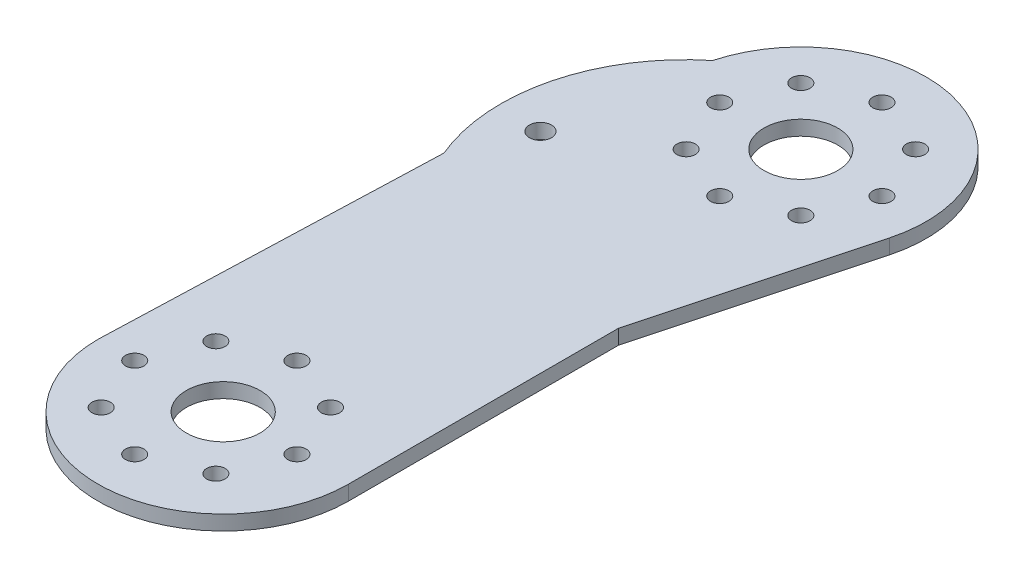
from build123d import *

# Parameters (mm, degrees)
RESSALTO_EXTRUS_O1_DEPTH      = 3
CORTE_EXTRUS_O8_REACH         = 92.666
ESBO_O7_R                     = 1.25
CORTE_EXTRUS_O9_REACH         = 92.666
ESBO_O8_R                     = 5
ESBO_O8_R_2                   = 1.5
CORTE_EXTRUS_O11_REACH        = 92.666
ESBO_O9_R                     = 1.25
CORTE_EXTRUS_O12_REACH        = 92.666
ESBO_O11_R                    = 5
CONVERTER_S_LIDO1_OUTLINE_R   = 1.25
CONVERTER_S_LIDO1_OUTLINE_R_2 = 5
CONVERTER_S_LIDO1_OUTLINE_R_3 = 1.5
CONVERTER_S_LIDO1_DEPTH       = 1


# Read off the part's stored shape, not the designer's step: Converter-Sólido1
with BuildPart() as part:
    # Esboço1 → Ressalto-extrusão1 (new body)
    with BuildSketch(Plane(origin=(0, 0, 0), x_dir=(1, 0, 0), z_dir=(0, 1, 0))):
        with BuildLine():
            Line((17, 36.622301445), (24.764571353, 65.600076233))
            ThreePointArc((24.764571353, 65.600076233), (12.765450327, 86.414910724), (-8.065221434, 74.443304555))
            ThreePointArc((-8.065221434, 74.443304555), (-16.588225274, 61.125706966), (-15.416069793, 45.357826591))
            Line((-15.416069793, 45.357826591), (-17, 0))
            ThreePointArc((-17, 0), (0, -17), (17, 0))
            Line((17, 0), (17, 36.622301445))
        make_face()
    extrude(amount=RESSALTO_EXTRUS_O1_DEPTH)

    # Esboço7 → Corte-extrusão8 (cut, up to next)
    with BuildSketch(Plane.XZ, mode=Mode.PRIVATE) as corte_extrus_o8_sk1:
        with Locations(Location((-1, -11, 0), (0, 0, 270))):
            Circle(ESBO_O7_R)
    corte_extrus_o8_tool1 = extrude(corte_extrus_o8_sk1.sketch, amount=-CORTE_EXTRUS_O8_REACH, mode=Mode.PRIVATE) & part.part
    # Esboço7 → Corte-extrusão8 (cut, up to next)
    with BuildSketch(Plane.XZ, mode=Mode.PRIVATE) as corte_extrus_o8_sk2:
        with Locations(Location((-8.778174593, -7.778174593, 0), (0, 0, 270))):
            Circle(ESBO_O7_R)
    corte_extrus_o8_tool2 = extrude(corte_extrus_o8_sk2.sketch, amount=-CORTE_EXTRUS_O8_REACH, mode=Mode.PRIVATE) & part.part
    # Esboço7 → Corte-extrusão8 (cut, up to next)
    with BuildSketch(Plane.XZ, mode=Mode.PRIVATE) as corte_extrus_o8_sk3:
        with Locations(Location((-12, 0, 0), (0, 0, 270))):
            Circle(ESBO_O7_R)
    corte_extrus_o8_tool3 = extrude(corte_extrus_o8_sk3.sketch, amount=-CORTE_EXTRUS_O8_REACH, mode=Mode.PRIVATE) & part.part
    # Esboço7 → Corte-extrusão8 (cut, up to next)
    with BuildSketch(Plane.XZ, mode=Mode.PRIVATE) as corte_extrus_o8_sk4:
        with Locations(Location((-8.778174593, 7.778174593, 0), (0, 0, 270))):
            Circle(ESBO_O7_R)
    corte_extrus_o8_tool4 = extrude(corte_extrus_o8_sk4.sketch, amount=-CORTE_EXTRUS_O8_REACH, mode=Mode.PRIVATE) & part.part
    # Esboço7 → Corte-extrusão8 (cut, up to next)
    with BuildSketch(Plane.XZ, mode=Mode.PRIVATE) as corte_extrus_o8_sk5:
        with Locations(Location((-1, 11, 0), (0, 0, 270))):
            Circle(ESBO_O7_R)
    corte_extrus_o8_tool5 = extrude(corte_extrus_o8_sk5.sketch, amount=-CORTE_EXTRUS_O8_REACH, mode=Mode.PRIVATE) & part.part
    # Esboço7 → Corte-extrusão8 (cut, up to next)
    with BuildSketch(Plane.XZ, mode=Mode.PRIVATE) as corte_extrus_o8_sk6:
        with Locations(Location((6.778174593, 7.778174593, 0), (0, 0, 270))):
            Circle(ESBO_O7_R)
    corte_extrus_o8_tool6 = extrude(corte_extrus_o8_sk6.sketch, amount=-CORTE_EXTRUS_O8_REACH, mode=Mode.PRIVATE) & part.part
    # Esboço7 → Corte-extrusão8 (cut, up to next)
    with BuildSketch(Plane.XZ, mode=Mode.PRIVATE) as corte_extrus_o8_sk7:
        with Locations(Location((10, 0, 0), (0, 0, 270))):
            Circle(ESBO_O7_R)
    corte_extrus_o8_tool7 = extrude(corte_extrus_o8_sk7.sketch, amount=-CORTE_EXTRUS_O8_REACH, mode=Mode.PRIVATE) & part.part
    # Esboço7 → Corte-extrusão8 (cut, up to next)
    with BuildSketch(Plane.XZ, mode=Mode.PRIVATE) as corte_extrus_o8_sk8:
        with Locations(Location((6.778174593, -7.778174593, 0), (0, 0, 270))):
            Circle(ESBO_O7_R)
    corte_extrus_o8_tool8 = extrude(corte_extrus_o8_sk8.sketch, amount=-CORTE_EXTRUS_O8_REACH, mode=Mode.PRIVATE) & part.part
    add(corte_extrus_o8_tool1.solids().sort_by_distance((-1, 0, -11))[0], mode=Mode.SUBTRACT)
    add(corte_extrus_o8_tool2.solids().sort_by_distance((-8.778175, 0, -7.778175))[0], mode=Mode.SUBTRACT)
    add(corte_extrus_o8_tool3.solids().sort_by_distance((-12, 0, 0))[0], mode=Mode.SUBTRACT)
    add(corte_extrus_o8_tool4.solids().sort_by_distance((-8.778175, 0, 7.778175))[0], mode=Mode.SUBTRACT)
    add(corte_extrus_o8_tool5.solids().sort_by_distance((-1, 0, 11))[0], mode=Mode.SUBTRACT)
    add(corte_extrus_o8_tool6.solids().sort_by_distance((6.778175, 0, 7.778175))[0], mode=Mode.SUBTRACT)
    add(corte_extrus_o8_tool7.solids().sort_by_distance((10, 0, 0))[0], mode=Mode.SUBTRACT)
    add(corte_extrus_o8_tool8.solids().sort_by_distance((6.778175, 0, -7.778175))[0], mode=Mode.SUBTRACT)

    # Esboço8 → Corte-extrusão9 (cut, up to next)
    with BuildSketch(Plane(origin=(0, 3, 0), x_dir=(1, 0, 0), z_dir=(0, 1, 0)), mode=Mode.PRIVATE) as corte_extrus_o9_sk1:
        with Locations(Location((0, 0, 0), (0, 0, 270))):
            Circle(ESBO_O8_R)
    corte_extrus_o9_tool1 = extrude(corte_extrus_o9_sk1.sketch, amount=-CORTE_EXTRUS_O9_REACH, mode=Mode.PRIVATE) & part.part
    # Esboço8 → Corte-extrusão9 (cut, up to next)
    with BuildSketch(Plane(origin=(0, 3, 0), x_dir=(1, 0, 0), z_dir=(0, 1, 0)), mode=Mode.PRIVATE) as corte_extrus_o9_sk2:
        with Locations(Location((-11.416069793, 54.443304555, 0), (0, 0, 270))):
            Circle(ESBO_O8_R_2)
    corte_extrus_o9_tool2 = extrude(corte_extrus_o9_sk2.sketch, amount=-CORTE_EXTRUS_O9_REACH, mode=Mode.PRIVATE) & part.part
    add(corte_extrus_o9_tool1.solids().sort_by_distance((0, 3, 0))[0], mode=Mode.SUBTRACT)
    add(corte_extrus_o9_tool2.solids().sort_by_distance((-11.41607, 3, -54.443305))[0], mode=Mode.SUBTRACT)

    # Esboço9 → Corte-extrusão11 (cut, up to next)
    with BuildSketch(Plane(origin=(0, 3, 0), x_dir=(1, 0, 0), z_dir=(0, 1, 0)), mode=Mode.PRIVATE) as corte_extrus_o11_sk1:
        with Locations(Location((8.343832306, 81, 0), (0, 0, 270))):
            Circle(ESBO_O9_R)
    corte_extrus_o11_tool1 = extrude(corte_extrus_o11_sk1.sketch, amount=-CORTE_EXTRUS_O11_REACH, mode=Mode.PRIVATE) & part.part
    # Esboço9 → Corte-extrusão11 (cut, up to next)
    with BuildSketch(Plane(origin=(0, 3, 0), x_dir=(1, 0, 0), z_dir=(0, 1, 0)), mode=Mode.PRIVATE) as corte_extrus_o11_sk2:
        with Locations(Location((16.122006899, 77.778174593, 0), (0, 0, 270))):
            Circle(ESBO_O9_R)
    corte_extrus_o11_tool2 = extrude(corte_extrus_o11_sk2.sketch, amount=-CORTE_EXTRUS_O11_REACH, mode=Mode.PRIVATE) & part.part
    # Esboço9 → Corte-extrusão11 (cut, up to next)
    with BuildSketch(Plane(origin=(0, 3, 0), x_dir=(1, 0, 0), z_dir=(0, 1, 0)), mode=Mode.PRIVATE) as corte_extrus_o11_sk3:
        with Locations(Location((19.343832306, 70, 0), (0, 0, 270))):
            Circle(ESBO_O9_R)
    corte_extrus_o11_tool3 = extrude(corte_extrus_o11_sk3.sketch, amount=-CORTE_EXTRUS_O11_REACH, mode=Mode.PRIVATE) & part.part
    # Esboço9 → Corte-extrusão11 (cut, up to next)
    with BuildSketch(Plane(origin=(0, 3, 0), x_dir=(1, 0, 0), z_dir=(0, 1, 0)), mode=Mode.PRIVATE) as corte_extrus_o11_sk4:
        with Locations(Location((16.122006899, 62.221825407, 0), (0, 0, 270))):
            Circle(ESBO_O9_R)
    corte_extrus_o11_tool4 = extrude(corte_extrus_o11_sk4.sketch, amount=-CORTE_EXTRUS_O11_REACH, mode=Mode.PRIVATE) & part.part
    # Esboço9 → Corte-extrusão11 (cut, up to next)
    with BuildSketch(Plane(origin=(0, 3, 0), x_dir=(1, 0, 0), z_dir=(0, 1, 0)), mode=Mode.PRIVATE) as corte_extrus_o11_sk5:
        with Locations(Location((8.343832306, 59, 0), (0, 0, 270))):
            Circle(ESBO_O9_R)
    corte_extrus_o11_tool5 = extrude(corte_extrus_o11_sk5.sketch, amount=-CORTE_EXTRUS_O11_REACH, mode=Mode.PRIVATE) & part.part
    # Esboço9 → Corte-extrusão11 (cut, up to next)
    with BuildSketch(Plane(origin=(0, 3, 0), x_dir=(1, 0, 0), z_dir=(0, 1, 0)), mode=Mode.PRIVATE) as corte_extrus_o11_sk6:
        with Locations(Location((0.565657713, 62.221825407, 0), (0, 0, 270))):
            Circle(ESBO_O9_R)
    corte_extrus_o11_tool6 = extrude(corte_extrus_o11_sk6.sketch, amount=-CORTE_EXTRUS_O11_REACH, mode=Mode.PRIVATE) & part.part
    # Esboço9 → Corte-extrusão11 (cut, up to next)
    with BuildSketch(Plane(origin=(0, 3, 0), x_dir=(1, 0, 0), z_dir=(0, 1, 0)), mode=Mode.PRIVATE) as corte_extrus_o11_sk7:
        with Locations(Location((-2.656167694, 70, 0), (0, 0, 270))):
            Circle(ESBO_O9_R)
    corte_extrus_o11_tool7 = extrude(corte_extrus_o11_sk7.sketch, amount=-CORTE_EXTRUS_O11_REACH, mode=Mode.PRIVATE) & part.part
    # Esboço9 → Corte-extrusão11 (cut, up to next)
    with BuildSketch(Plane(origin=(0, 3, 0), x_dir=(1, 0, 0), z_dir=(0, 1, 0)), mode=Mode.PRIVATE) as corte_extrus_o11_sk8:
        with Locations(Location((0.565657713, 77.778174593, 0), (0, 0, 270))):
            Circle(ESBO_O9_R)
    corte_extrus_o11_tool8 = extrude(corte_extrus_o11_sk8.sketch, amount=-CORTE_EXTRUS_O11_REACH, mode=Mode.PRIVATE) & part.part
    add(corte_extrus_o11_tool1.solids().sort_by_distance((8.343832, 3, -81))[0], mode=Mode.SUBTRACT)
    add(corte_extrus_o11_tool2.solids().sort_by_distance((16.122007, 3, -77.778175))[0], mode=Mode.SUBTRACT)
    add(corte_extrus_o11_tool3.solids().sort_by_distance((19.343832, 3, -70))[0], mode=Mode.SUBTRACT)
    add(corte_extrus_o11_tool4.solids().sort_by_distance((16.122007, 3, -62.221825))[0], mode=Mode.SUBTRACT)
    add(corte_extrus_o11_tool5.solids().sort_by_distance((8.343832, 3, -59))[0], mode=Mode.SUBTRACT)
    add(corte_extrus_o11_tool6.solids().sort_by_distance((0.565658, 3, -62.221825))[0], mode=Mode.SUBTRACT)
    add(corte_extrus_o11_tool7.solids().sort_by_distance((-2.656168, 3, -70))[0], mode=Mode.SUBTRACT)
    add(corte_extrus_o11_tool8.solids().sort_by_distance((0.565658, 3, -77.778175))[0], mode=Mode.SUBTRACT)

    # Esboço11 → Corte-extrusão12 (cut, up to next)
    with BuildSketch(Plane(origin=(0, 3, 0), x_dir=(1, 0, 0), z_dir=(0, 1, 0)), mode=Mode.PRIVATE) as corte_extrus_o12_sk1:
        with Locations(Location((8.343832306, 70, 0), (0, 0, 270))):
            Circle(ESBO_O11_R)
    corte_extrus_o12_tool1 = extrude(corte_extrus_o12_sk1.sketch, amount=-CORTE_EXTRUS_O12_REACH, mode=Mode.PRIVATE) & part.part
    add(corte_extrus_o12_tool1.solids().sort_by_distance((8.343832, 3, -70))[0], mode=Mode.SUBTRACT)

    # Converter-Sólido1 outline → Converter-Sólido1 (cut)
    with BuildSketch(Plane(origin=(0, 0, 0), x_dir=(1, 0, 0), z_dir=(0, 1, 0))):
        with BuildLine():
            ThreePointArc((24.764571353, 65.600076233), (12.765450327, 86.414910724), (-8.065221434, 74.443304555))
            ThreePointArc((-8.065221434, 74.443304555), (-16.588225274, 61.125706966), (-15.416069793, 45.357826591))
            Line((-15.416069793, 45.357826591), (-17, 0))
            ThreePointArc((-17, 0), (0, -17), (17, 0))
            Line((17, 0), (17, 36.622301445))
            Line((17, 36.622301445), (24.764571353, 65.600076233))
        make_face()
        with Locations((-8.778174593, -7.778174593)):
            Circle(CONVERTER_S_LIDO1_OUTLINE_R, mode=Mode.SUBTRACT)
        with Locations((-12, 0)):
            Circle(CONVERTER_S_LIDO1_OUTLINE_R, mode=Mode.SUBTRACT)
        with Locations((-8.778174593, 7.778174593)):
            Circle(CONVERTER_S_LIDO1_OUTLINE_R, mode=Mode.SUBTRACT)
        with Locations((-1, -11)):
            Circle(CONVERTER_S_LIDO1_OUTLINE_R, mode=Mode.SUBTRACT)
        Circle(CONVERTER_S_LIDO1_OUTLINE_R_2, mode=Mode.SUBTRACT)
        with Locations((-1, 11)):
            Circle(CONVERTER_S_LIDO1_OUTLINE_R, mode=Mode.SUBTRACT)
        with Locations((6.778174593, -7.778174593)):
            Circle(CONVERTER_S_LIDO1_OUTLINE_R, mode=Mode.SUBTRACT)
        with Locations((6.778174593, 7.778174593)):
            Circle(CONVERTER_S_LIDO1_OUTLINE_R, mode=Mode.SUBTRACT)
        with Locations((10, 0)):
            Circle(CONVERTER_S_LIDO1_OUTLINE_R, mode=Mode.SUBTRACT)
        with Locations((-11.416069793, 54.443304555)):
            Circle(CONVERTER_S_LIDO1_OUTLINE_R_3, mode=Mode.SUBTRACT)
        with Locations((-2.656167694, 70)):
            Circle(CONVERTER_S_LIDO1_OUTLINE_R, mode=Mode.SUBTRACT)
        with Locations((0.565657713, 62.221825407)):
            Circle(CONVERTER_S_LIDO1_OUTLINE_R, mode=Mode.SUBTRACT)
        with Locations((0.565657713, 77.778174593)):
            Circle(CONVERTER_S_LIDO1_OUTLINE_R, mode=Mode.SUBTRACT)
        with Locations((8.343832306, 59)):
            Circle(CONVERTER_S_LIDO1_OUTLINE_R, mode=Mode.SUBTRACT)
        with Locations((8.343832306, 70)):
            Circle(CONVERTER_S_LIDO1_OUTLINE_R_2, mode=Mode.SUBTRACT)
        with Locations((8.343832306, 81)):
            Circle(CONVERTER_S_LIDO1_OUTLINE_R, mode=Mode.SUBTRACT)
        with Locations((16.122006899, 62.221825407)):
            Circle(CONVERTER_S_LIDO1_OUTLINE_R, mode=Mode.SUBTRACT)
        with Locations((19.343832306, 70)):
            Circle(CONVERTER_S_LIDO1_OUTLINE_R, mode=Mode.SUBTRACT)
        with Locations((16.122006899, 77.778174593)):
            Circle(CONVERTER_S_LIDO1_OUTLINE_R, mode=Mode.SUBTRACT)
    extrude(amount=CONVERTER_S_LIDO1_DEPTH, mode=Mode.SUBTRACT)


solid = part.part
